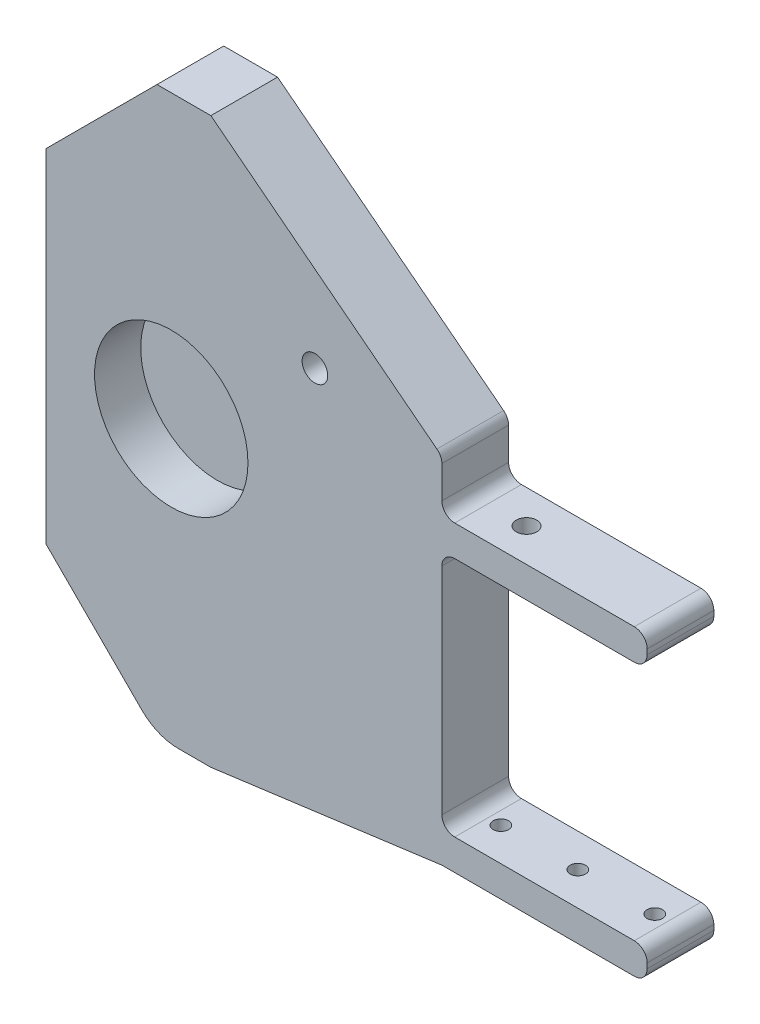
from build123d import *

# Parameters (mm, degrees)
RESSALTO_EXTRUS_O1_DEPTH = 6.5
ESBO_O2_R                = 14.95
CORTE_EXTRUS_O1_DEPTH    = 9
ESBO_O3_R                = 2.5
CORTE_EXTRUS_O2_DEPTH    = 13
FILETE1_R                = 10
ESBO_O4_R                = 2
CORTE_EXTRUS_O3_DEPTH    = 10
ESBO_O6_R                = 2
CORTE_EXTRUS_O4_DEPTH    = 10
ESBO_O7_R                = 1.5
CORTE_EXTRUS_O5_DEPTH    = 10
FILETE2_R                = 2.5


with BuildPart() as part:
    # Esboço1 → Ressalto-extrusão1 (new, symmetric)
    with BuildSketch(Plane.XY):
        Polygon((32.742040246, 55), (4.980147158, 55), (-22.781745931, 55), (-44.375431078, 33.406314852), (-44.375431078, -33.406314852), (-22.781745931, -55), (32.742040246, -55), (32.742040246, -49), (72.742040246, -49), (72.742040246, -43), (32.742040246, -43), (32.742040246, 4), (72.742040246, 4), (72.742040246, 10), (32.742040246, 10), align=None)
    extrude(amount=RESSALTO_EXTRUS_O1_DEPTH, both=True)

    # Esboço2 → Corte-extrusão1 (cut)
    with BuildSketch(Plane.XY.offset(6.5)):
        with Locations((-20, 0)):
            Circle(ESBO_O2_R)
    extrude(amount=-CORTE_EXTRUS_O1_DEPTH, mode=Mode.SUBTRACT)

    # Esboço3 → Corte-extrusão2 (cut)
    with BuildSketch(Plane.XY.offset(6.5)):
        with Locations((8, 22.5)):
            Circle(ESBO_O3_R)
        Polygon((-12.281745931, -55), (32.742040246, -49), (32.742040246, -55), align=None)
        Polygon((32.742040246, 55), (-12.281745931, 55), (32.742040246, 20), align=None)
    extrude(amount=-CORTE_EXTRUS_O2_DEPTH, mode=Mode.SUBTRACT)

    # Filete1
    filete1_edges = [part.edges().sort_by_distance(p)[0] for p in [
        (-22.781745931, -55, 0),
    ]]
    fillet(filete1_edges, radius=FILETE1_R)

    # Esboço4 → Corte-extrusão3 (cut)
    with BuildSketch(Plane(origin=(0, 0, -6.5), x_dir=(-1, 0, 0), z_dir=(0, 0, -1))):
        with Locations((36.375431078, 8.406314852)):
            Circle(ESBO_O4_R)
        with Locations((12.955431078, -16.593685148)):
            Circle(ESBO_O4_R)
        with Locations((22.375431078, -27.593685148)):
            Circle(ESBO_O4_R)
    extrude(amount=-CORTE_EXTRUS_O3_DEPTH, mode=Mode.SUBTRACT)

    # Esboço6 → Corte-extrusão4 (cut)
    with BuildSketch(Plane(origin=(0, 10, 0), x_dir=(1, 0, 0), z_dir=(0, 1, 0))):
        with Locations((42.742040246, -0.001621735)):
            Circle(ESBO_O6_R)
        with Locations((45.555134819, -19.802795916)):
            Circle(ESBO_O6_R)
    extrude(amount=-CORTE_EXTRUS_O4_DEPTH, mode=Mode.SUBTRACT)

    # Esboço7 → Corte-extrusão5 (cut)
    with BuildSketch(Plane.XZ.offset(49)):
        with Locations((37.742040246, 0)):
            Circle(ESBO_O7_R)
        with Locations((52.742040246, 0)):
            Circle(ESBO_O7_R)
        with Locations((67.742040246, 0)):
            Circle(ESBO_O7_R)
    extrude(amount=-CORTE_EXTRUS_O5_DEPTH, mode=Mode.SUBTRACT)

    # Filete2
    filete2_edges = [part.edges().sort_by_distance(p)[0] for p in [
        (72.742040246, -49, 0),
        (72.742040246, -43, 0),
        (72.742040246, 4, 0),
        (72.742040246, 10, 0),
        (32.742040246, 20, 0),
        (32.742040246, -43, 0),
        (32.742040246, 10, 0),
        (32.742040246, 4, 0),
    ]]
    fillet(filete2_edges, radius=FILETE2_R)


solid = part.part
